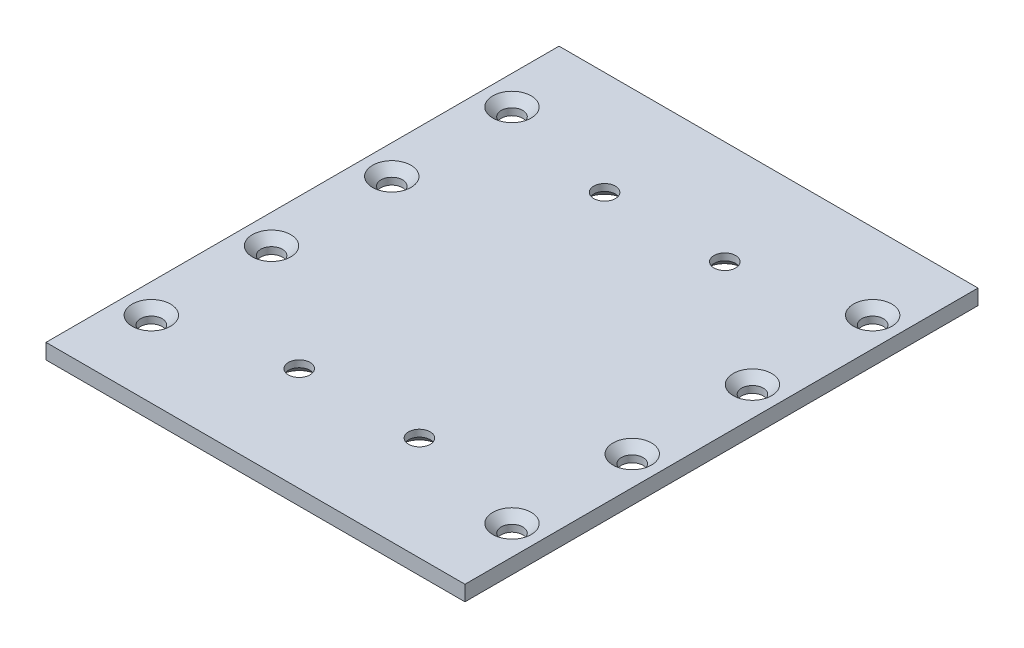
from build123d import *

# Parameters (mm, degrees)
SKETCH2_W                    = 87.12
SKETCH2_H                    = 106.68
BOSS_EXTRUDE1_DEPTH          = 3.175
CSK_FOR_M4_SFHCS1_AT_2_COUNT = 2
CSK_FOR_M4_SFHCS1_AT_2_PITCH = 25


# Read off the part's stored shape, not the designer's step: AdvancedHole2
with BuildPart() as part:
    # Sketch2 → Boss-Extrude1 (new body)
    with BuildSketch(Plane(origin=(0, 0, 0), x_dir=(1, 0, 0), z_dir=(0, 1, 0))):
        Rectangle(SKETCH2_W, SKETCH2_H)
    extrude(amount=BOSS_EXTRUDE1_DEPTH)

    # AdvancedHole2 outline → AdvancedHole2 (revolve, cut)
    with BuildSketch(Plane(origin=(-37.5, 0, 12.5), x_dir=(1, 0, 0), z_dir=(0, 0, 1))):
        Polygon((4, 3.175), (0, 3.175), (0, 0), (2.25, 0), (2.25, 1.425), align=None)
    revolve(axis=Axis((-37.5, 0, 12.5), (0, 1, 0)), mode=Mode.SUBTRACT)

    # AdvancedHole2 2 outline → AdvancedHole2 2 (revolve, cut)
    with BuildSketch(Plane(origin=(-37.5, 0, 37.5), x_dir=(1, 0, 0), z_dir=(0, 0, 1))):
        Polygon((4, 3.175), (0, 3.175), (0, 0), (2.25, 0), (2.25, 1.425), align=None)
    revolve(axis=Axis((-37.5, 0, 37.5), (0, 1, 0)), mode=Mode.SUBTRACT)

    # AdvancedHole2 3 outline → AdvancedHole2 3 (revolve, cut)
    with BuildSketch(Plane(origin=(37.5, 0, 37.5), x_dir=(1, 0, 0), z_dir=(0, 0, 1))):
        Polygon((4, 3.175), (0, 3.175), (0, 0), (2.25, 0), (2.25, 1.425), align=None)
    revolve(axis=Axis((37.5, 0, 37.5), (0, 1, 0)), mode=Mode.SUBTRACT)

    # AdvancedHole2 4 outline → AdvancedHole2 4 (revolve, cut)
    with BuildSketch(Plane(origin=(37.5, 0, 12.5), x_dir=(1, 0, 0), z_dir=(0, 0, 1))):
        Polygon((4, 3.175), (0, 3.175), (0, 0), (2.25, 0), (2.25, 1.425), align=None)
    revolve(axis=Axis((37.5, 0, 12.5), (0, 1, 0)), mode=Mode.SUBTRACT)

    # AdvancedHole2 5 outline → AdvancedHole2 5 (revolve, cut)
    with BuildSketch(Plane(origin=(37.5, 0, -12.5), x_dir=(1, 0, 0), z_dir=(0, 0, 1))):
        Polygon((4, 3.175), (0, 3.175), (0, 0), (2.25, 0), (2.25, 1.425), align=None)
    revolve(axis=Axis((37.5, 0, -12.5), (0, 1, 0)), mode=Mode.SUBTRACT)

    # AdvancedHole2 6 outline → AdvancedHole2 6 (revolve, cut)
    with BuildSketch(Plane(origin=(37.5, 0, -37.5), x_dir=(1, 0, 0), z_dir=(0, 0, 1))):
        Polygon((4, 3.175), (0, 3.175), (0, 0), (2.25, 0), (2.25, 1.425), align=None)
    revolve(axis=Axis((37.5, 0, -37.5), (0, 1, 0)), mode=Mode.SUBTRACT)

    # AdvancedHole2 7 outline → AdvancedHole2 7 (revolve, cut)
    with BuildSketch(Plane(origin=(-37.5, 0, -12.5), x_dir=(1, 0, 0), z_dir=(0, 0, 1))):
        Polygon((4, 3.175), (0, 3.175), (0, 0), (2.25, 0), (2.25, 1.425), align=None)
    revolve(axis=Axis((-37.5, 0, -12.5), (0, 1, 0)), mode=Mode.SUBTRACT)

    # AdvancedHole2 8 outline → AdvancedHole2 8 (revolve, cut)
    with BuildSketch(Plane(origin=(-37.5, 0, -37.5), x_dir=(1, 0, 0), z_dir=(0, 0, 1))):
        Polygon((4, 3.175), (0, 3.175), (0, 0), (2.25, 0), (2.25, 1.425), align=None)
    revolve(axis=Axis((-37.5, 0, -37.5), (0, 1, 0)), mode=Mode.SUBTRACT)

    # Sketch21 → CSK for M4 SFHCS1 (revolve, cut)
    with BuildSketch(Plane(origin=(12.5, 0, -31.75), x_dir=(0, 0, -1), z_dir=(1, 0, 0))):
        Polygon((0, 0), (0, 11.351936393), (2.25, 10), (2.25, 1.75), (4, 0), align=None)
    csk_for_m4_sfhcs1 = revolve(axis=Axis((12.5, -6.35, -31.75), (0, 1, 0)), mode=Mode.SUBTRACT)

    # CSK for M4 SFHCS1 at 2: CSK for M4 SFHCS1 ×2
    with Locations(*[(-i * CSK_FOR_M4_SFHCS1_AT_2_PITCH, 0, 0) for i in range(1, CSK_FOR_M4_SFHCS1_AT_2_COUNT)]):
        add(csk_for_m4_sfhcs1, mode=Mode.SUBTRACT)

    # Mirror1: CSK for M4 SFHCS1 across plane
    add(csk_for_m4_sfhcs1.mirror(Plane.XY), mode=Mode.SUBTRACT)

    # Mirror1 copy 1 sketch → Mirror1 copy 1 (revolve, cut)
    with BuildSketch(Plane(origin=(-12.5, 0, 31.75), x_dir=(0, 0, 1), z_dir=(1, 0, 0))):
        Polygon((0, 0), (0, -11.351936393), (2.25, -10), (2.25, -1.75), (4, 0), align=None)
    revolve(axis=Axis((-12.5, -6.35, 31.75), (0, -1, 0)), mode=Mode.SUBTRACT)


solid = part.part
